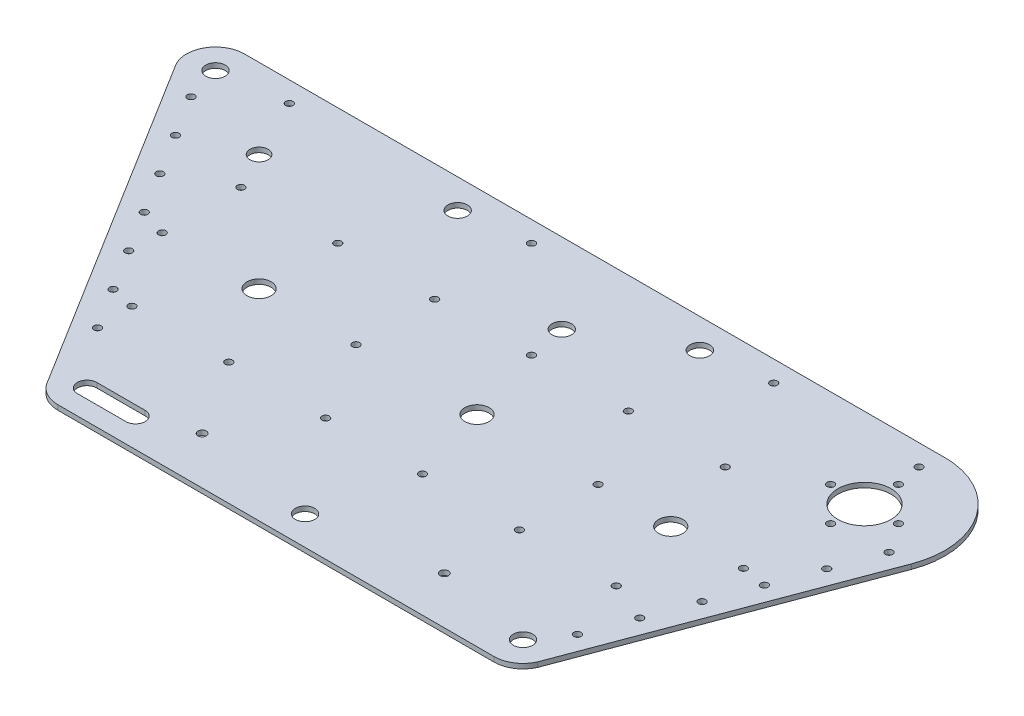
from build123d import *

# Parameters (mm, degrees)
SKETCH2_R           = 1.5
SKETCH2_R_2         = 1.75
SKETCH2_R_3         = 4
SKETCH2_R_4         = 5
BOSS_EXTRUDE1_DEPTH = 2


with BuildPart() as part:
    # Sketch2 → Boss-Extrude1 (new body)
    with BuildSketch(Plane(origin=(0, 0, 0), x_dir=(1, 0, 0), z_dir=(0, 1, 0))):
        with BuildLine():
            Line((182.962816245, 145.197156615), (-106.00499968, 144.943614194))
            add(Edge.make_bspline(
                [(-106.00499968, 144.943614194), (-127.678824036, 144.924558741), (-116.08526313, 126.611232779)],
                knots=[0.000879148, 0.000879148, 0.000879148, 2.135198153, 2.135198153, 2.135198153], degree=2, weights=[1, 0.482613975, 1]))
            Line((-116.08526313, 126.611232779), (-29.699861268, -12.428586042))
            add(Edge.make_bspline(
                [(-29.699861268, -12.428586042), (-26.366669696, -18.999958873), (-18.998606102, -18.99996049)],
                knots=[5.181825727, 5.181825727, 5.181825727, 6.283185508, 6.283185508, 6.283185508], degree=2, weights=[1, 0.852168955, 1]))
            Line((-18.998606102, -18.99996049), (160.992350179, -19))
            add(Edge.make_bspline(
                [(160.992350179, -19), (168.692373591, -19.000128232), (171.90071668, -12.000000001)],
                knots=[3.141576001, 3.141576001, 3.141576001, 4.282613549, 4.282613549, 4.282613549], degree=2, weights=[1, 0.841620915, 1]))
            Line((171.90071668, -12.000000001), (214.069631291, 100.332253712))
            add(Edge.make_bspline(
                [(214.069631291, 100.332253712), (230.927799732, 145.239327045), (182.962816245, 145.197156615)],
                knots=[4.353250182, 4.353250182, 4.353250182, 6.284064455, 6.284064455, 6.284064455], degree=2, weights=[1, 0.569082143, 1]))
        make_face()
        with Locations((-38.361920415, 16.671266638)):
            Circle(SKETCH2_R, mode=Mode.SUBTRACT)
        with BuildLine():
            add(Edge.make_bspline(
                [(-18.998603467, -3), (-22.998556935, -3), (-22.998556935, -7), (-22.998556935, -11), (-18.998603467, -11)],
                knots=[3.141592654, 3.141592654, 3.141592654, 4.71238898, 4.71238898, 6.283185307, 6.283185307, 6.283185307], degree=2, weights=[1, 0.707106781, 1, 0.707106781, 1]))
            Line((-18.998603467, -3), (1.00035, -3))
            add(Edge.make_bspline(
                [(1.00035, -11), (5.00035, -11), (5.00035, -7), (5.00035, -3), (1.00035, -3)],
                knots=[3.141592654, 3.141592654, 3.141592654, 4.71238898, 4.71238898, 6.283185307, 6.283185307, 6.283185307], degree=2, weights=[1, 0.707106781, 1, 0.707106781, 1]))
            Line((1.00035, -11), (-18.998603467, -11))
        make_face(mode=Mode.SUBTRACT)
        with Locations((20.99895, 0.5)):
            Circle(SKETCH2_R_2, mode=Mode.SUBTRACT)
        with BuildLine():
            add(Edge.make_bspline(
                [(-38.99805, 32.999994311), (-41.595996308, 32.999994311), (-40.297023154, 30.749994311), (-38.99805, 28.499994311), (-37.699076846, 30.749994311), (-36.400103692, 32.999994311), (-38.99805, 32.999994311)],
                knots=[0, 0, 0, 2.094395102, 2.094395102, 4.188790205, 4.188790205, 6.283185307, 6.283185307, 6.283185307], degree=2, weights=[1, 0.5, 1, 0.5, 1, 0.5, 1]))
        make_face(mode=Mode.SUBTRACT)
        with Locations((-48.916261932, 33.658786529)):
            Circle(SKETCH2_R, mode=Mode.SUBTRACT)
        with Locations((-59.470762984, 50.646563195)):
            Circle(SKETCH2_R, mode=Mode.SUBTRACT)
        with BuildLine():
            add(Edge.make_bspline(
                [(0.99995, 32.999992415), (-1.597996308, 32.999992415), (-0.299023154, 30.749992415), (0.99995, 28.499992415), (2.298923154, 30.749992415), (3.597896308, 32.999992415), (0.99995, 32.999992415)],
                knots=[0, 0, 0, 2.094395102, 2.094395102, 4.188790205, 4.188790205, 6.283185307, 6.283185307, 6.283185307], degree=2, weights=[1, 0.5, 1, 0.5, 1, 0.5, 1]))
        make_face(mode=Mode.SUBTRACT)
        with BuildLine():
            add(Edge.make_bspline(
                [(40.99795, 32.999988622), (38.400003692, 32.999988622), (39.698976846, 30.749988622), (40.99795, 28.499988622), (42.296923154, 30.749988622), (43.595896308, 32.999988622), (40.99795, 32.999988622)],
                knots=[0, 0, 0, 2.094395102, 2.094395102, 4.188790205, 4.188790205, 6.283185307, 6.283185307, 6.283185307], degree=2, weights=[1, 0.5, 1, 0.5, 1, 0.5, 1]))
        make_face(mode=Mode.SUBTRACT)
        with Locations((70.99665, -7)):
            Circle(SKETCH2_R_3, mode=Mode.SUBTRACT)
        with Locations((120.99395, 0.5)):
            Circle(SKETCH2_R_2, mode=Mode.SUBTRACT)
        with BuildLine():
            add(Edge.make_bspline(
                [(160.99255, -3), (154.06434677, -3), (157.528448385, -9), (160.99255, -15), (164.456651615, -9), (167.92075323, -3), (160.99255, -3)],
                knots=[0, 0, 0, 2.094395102, 2.094395102, 4.188790205, 4.188790205, 6.283185307, 6.283185307, 6.283185307], degree=2, weights=[1, 0.5, 1, 0.5, 1, 0.5, 1]))
        make_face(mode=Mode.SUBTRACT)
        with Locations((170.332531489, 6.118627774)):
            Circle(SKETCH2_R, mode=Mode.SUBTRACT)
        with BuildLine():
            add(Edge.make_bspline(
                [(80.99595, 32.999985778), (78.398003692, 32.999985778), (79.696976846, 30.749985778), (80.99595, 28.499985778), (82.294923154, 30.749985778), (83.593896308, 32.999985778), (80.99595, 32.999985778)],
                knots=[0, 0, 0, 2.094395102, 2.094395102, 4.188790205, 4.188790205, 6.283185307, 6.283185307, 6.283185307], degree=2, weights=[1, 0.5, 1, 0.5, 1, 0.5, 1]))
        make_face(mode=Mode.SUBTRACT)
        with BuildLine():
            add(Edge.make_bspline(
                [(120.99395, 32.999981037), (118.396003692, 32.999981037), (119.694976846, 30.749981037), (120.99395, 28.499981037), (122.292923154, 30.749981037), (123.591896308, 32.999981037), (120.99395, 32.999981037)],
                knots=[0, 0, 0, 2.094395102, 2.094395102, 4.188790205, 4.188790205, 6.283185307, 6.283185307, 6.283185307], degree=2, weights=[1, 0.5, 1, 0.5, 1, 0.5, 1]))
        make_face(mode=Mode.SUBTRACT)
        with BuildLine():
            add(Edge.make_bspline(
                [(160.99195, 32.999978192), (158.394003692, 32.999978192), (159.692976846, 30.749978192), (160.99195, 28.499978192), (162.290923154, 30.749978192), (163.589896308, 32.999978192), (160.99195, 32.999978192)],
                knots=[0, 0, 0, 2.094395102, 2.094395102, 4.188790205, 4.188790205, 6.283185307, 6.283185307, 6.283185307], degree=2, weights=[1, 0.5, 1, 0.5, 1, 0.5, 1]))
        make_face(mode=Mode.SUBTRACT)
        with Locations((177.330672341, 24.854456596)):
            Circle(SKETCH2_R, mode=Mode.SUBTRACT)
        with Locations((184.328557385, 43.589600555)):
            Circle(SKETCH2_R, mode=Mode.SUBTRACT)
        with Locations((191.32646769, 62.324812144)):
            Circle(SKETCH2_R, mode=Mode.SUBTRACT)
        with Locations((-70.02547384, 67.634677545)):
            Circle(SKETCH2_R, mode=Mode.SUBTRACT)
        with BuildLine():
            add(Edge.make_bspline(
                [(-58.99705, 65.5), (-61.594996308, 65.5), (-60.296023154, 63.25), (-58.99705, 61), (-57.698076846, 63.25), (-56.399103692, 65.5), (-58.99705, 65.5)],
                knots=[0, 0, 0, 2.094395102, 2.094395102, 4.188790205, 4.188790205, 6.283185307, 6.283185307, 6.283185307], degree=2, weights=[1, 0.5, 1, 0.5, 1, 0.5, 1]))
        make_face(mode=Mode.SUBTRACT)
        with BuildLine():
            add(Edge.make_bspline(
                [(-91.134705429, 103.110600241), (-93.732651737, 103.110600241), (-92.433678583, 100.860600241), (-91.134705429, 98.610600241), (-89.835732276, 100.860600241), (-88.536759122, 103.110600241), (-91.134705429, 103.110600241)],
                knots=[0, 0, 0, 2.094395102, 2.094395102, 4.188790205, 4.188790205, 6.283185307, 6.283185307, 6.283185307], degree=2, weights=[1, 0.5, 1, 0.5, 1, 0.5, 1]))
        make_face(mode=Mode.SUBTRACT)
        with Locations((-80.580283096, 84.622950275)):
            Circle(SKETCH2_R, mode=Mode.SUBTRACT)
        with BuildLine():
            add(Edge.make_bspline(
                [(-58.99705, 98), (-61.594996308, 98), (-60.296023154, 95.75), (-58.99705, 93.5), (-57.698076846, 95.75), (-56.399103692, 98), (-58.99705, 98)],
                knots=[0, 0, 0, 2.094395102, 2.094395102, 4.188790205, 4.188790205, 6.283185307, 6.283185307, 6.283185307], degree=2, weights=[1, 0.5, 1, 0.5, 1, 0.5, 1]))
        make_face(mode=Mode.SUBTRACT)
        with Locations((-18.9988, 64)):
            Circle(SKETCH2_R_4, mode=Mode.SUBTRACT)
        with BuildLine():
            add(Edge.make_bspline(
                [(20.99895, 65.5), (18.401003692, 65.5), (19.699976846, 63.25), (20.99895, 61), (22.297923154, 63.25), (23.596896308, 65.5), (20.99895, 65.5)],
                knots=[0, 0, 0, 2.094395102, 2.094395102, 4.188790205, 4.188790205, 6.283185307, 6.283185307, 6.283185307], degree=2, weights=[1, 0.5, 1, 0.5, 1, 0.5, 1]))
        make_face(mode=Mode.SUBTRACT)
        with BuildLine():
            add(Edge.make_bspline(
                [(-18.99905, 98), (-21.596996308, 98), (-20.298023154, 95.75), (-18.99905, 93.5), (-17.700076846, 95.75), (-16.401103692, 98), (-18.99905, 98)],
                knots=[0, 0, 0, 2.094395102, 2.094395102, 4.188790205, 4.188790205, 6.283185307, 6.283185307, 6.283185307], degree=2, weights=[1, 0.5, 1, 0.5, 1, 0.5, 1]))
        make_face(mode=Mode.SUBTRACT)
        with BuildLine():
            add(Edge.make_bspline(
                [(20.99895, 98), (18.401003692, 98), (19.699976846, 95.75), (20.99895, 93.5), (22.297923154, 95.75), (23.596896308, 98), (20.99895, 98)],
                knots=[0, 0, 0, 2.094395102, 2.094395102, 4.188790205, 4.188790205, 6.283185307, 6.283185307, 6.283185307], degree=2, weights=[1, 0.5, 1, 0.5, 1, 0.5, 1]))
        make_face(mode=Mode.SUBTRACT)
        with BuildLine():
            add(Edge.make_bspline(
                [(-101.689209002, 120.098380963), (-104.287155309, 120.098380963), (-102.988182156, 117.848380963), (-101.689209002, 115.598380963), (-100.390235848, 117.848380963), (-99.091262694, 120.098380963), (-101.689209002, 120.098380963)],
                knots=[0, 0, 0, 2.094395102, 2.094395102, 4.188790205, 4.188790205, 6.283185307, 6.283185307, 6.283185307], degree=2, weights=[1, 0.5, 1, 0.5, 1, 0.5, 1]))
        make_face(mode=Mode.SUBTRACT)
        with BuildLine():
            add(Edge.make_bspline(
                [(-66.99665, 115.75), (-73.491515769, 115.75), (-70.244082884, 110.125), (-66.99665, 104.5), (-63.749217116, 110.125), (-60.501784231, 115.75), (-66.99665, 115.75)],
                knots=[0, 0, 0, 2.094395102, 2.094395102, 4.188790205, 4.188790205, 6.283185307, 6.283185307, 6.283185307], degree=2, weights=[1, 0.5, 1, 0.5, 1, 0.5, 1]))
        make_face(mode=Mode.SUBTRACT)
        with BuildLine():
            add(Edge.make_bspline(
                [(-109.9945, 133), (-109.9945, 126.07179677), (-103.9945, 129.535898385), (-97.9945, 133), (-103.9945, 136.464101615), (-109.9945, 139.92820323), (-109.9945, 133)],
                knots=[0, 0, 0, 2.094395102, 2.094395102, 4.188790205, 4.188790205, 6.283185307, 6.283185307, 6.283185307], degree=2, weights=[1, 0.5, 1, 0.5, 1, 0.5, 1]))
        make_face(mode=Mode.SUBTRACT)
        with Locations((-78.996040132, 136.5)):
            Circle(SKETCH2_R, mode=Mode.SUBTRACT)
        with BuildLine():
            add(Edge.make_bspline(
                [(-5.9995, 137), (-12.92770323, 137), (-9.463601615, 131), (-5.9995, 125), (-2.535398385, 131), (0.92870323, 137), (-5.9995, 137)],
                knots=[0, 0, 0, 2.094395102, 2.094395102, 4.188790205, 4.188790205, 6.283185307, 6.283185307, 6.283185307], degree=2, weights=[1, 0.5, 1, 0.5, 1, 0.5, 1]))
        make_face(mode=Mode.SUBTRACT)
        with Locations((20.99895, 136.5)):
            Circle(SKETCH2_R, mode=Mode.SUBTRACT)
        with Locations((70.99645, 64)):
            Circle(SKETCH2_R_4, mode=Mode.SUBTRACT)
        with BuildLine():
            add(Edge.make_bspline(
                [(120.99395, 65.5), (118.396003692, 65.5), (119.694976846, 63.25), (120.99395, 61), (122.292923154, 63.25), (123.591896308, 65.5), (120.99395, 65.5)],
                knots=[0, 0, 0, 2.094395102, 2.094395102, 4.188790205, 4.188790205, 6.283185307, 6.283185307, 6.283185307], degree=2, weights=[1, 0.5, 1, 0.5, 1, 0.5, 1]))
        make_face(mode=Mode.SUBTRACT)
        with BuildLine():
            add(Edge.make_bspline(
                [(60.99695, 98), (58.399003692, 98), (59.697976846, 95.75), (60.99695, 93.5), (62.295923154, 95.75), (63.594896308, 98), (60.99695, 98)],
                knots=[0, 0, 0, 2.094395102, 2.094395102, 4.188790205, 4.188790205, 6.283185307, 6.283185307, 6.283185307], degree=2, weights=[1, 0.5, 1, 0.5, 1, 0.5, 1]))
        make_face(mode=Mode.SUBTRACT)
        with BuildLine():
            add(Edge.make_bspline(
                [(100.99495, 98), (98.397003692, 98), (99.695976846, 95.75), (100.99495, 93.5), (102.293923154, 95.75), (103.592896308, 98), (100.99495, 98)],
                knots=[0, 0, 0, 2.094395102, 2.094395102, 4.188790205, 4.188790205, 6.283185307, 6.283185307, 6.283185307], degree=2, weights=[1, 0.5, 1, 0.5, 1, 0.5, 1]))
        make_face(mode=Mode.SUBTRACT)
        with BuildLine():
            add(Edge.make_bspline(
                [(140.99295, 98), (138.395003692, 98), (139.693976846, 95.75), (140.99295, 93.5), (142.291923154, 95.75), (143.590896308, 98), (140.99295, 98)],
                knots=[0, 0, 0, 2.094395102, 2.094395102, 4.188790205, 4.188790205, 6.283185307, 6.283185307, 6.283185307], degree=2, weights=[1, 0.5, 1, 0.5, 1, 0.5, 1]))
        make_face(mode=Mode.SUBTRACT)
        with Locations((150.9927, 64)):
            Circle(SKETCH2_R_4, mode=Mode.SUBTRACT)
        with BuildLine():
            add(Edge.make_bspline(
                [(180.99095, 65.5), (178.393003692, 65.5), (179.691976846, 63.25), (180.99095, 61), (182.289923154, 63.25), (183.588896308, 65.5), (180.99095, 65.5)],
                knots=[0, 0, 0, 2.094395102, 2.094395102, 4.188790205, 4.188790205, 6.283185307, 6.283185307, 6.283185307], degree=2, weights=[1, 0.5, 1, 0.5, 1, 0.5, 1]))
        make_face(mode=Mode.SUBTRACT)
        with Locations((198.324441471, 81.060193672)):
            Circle(SKETCH2_R, mode=Mode.SUBTRACT)
        with BuildLine():
            add(Edge.make_bspline(
                [(182.99085, 99.5), (180.392903692, 99.5), (181.691876846, 97.25), (182.99085, 95), (184.289823154, 97.25), (185.588796308, 99.5), (182.99085, 99.5)],
                knots=[0, 0, 0, 2.094395102, 2.094395102, 4.188790205, 4.188790205, 6.283185307, 6.283185307, 6.283185307], degree=2, weights=[1, 0.5, 1, 0.5, 1, 0.5, 1]))
        make_face(mode=Mode.SUBTRACT)
        with BuildLine():
            add(Edge.make_bspline(
                [(205.322481122, 101.295751553), (202.724534814, 101.295751553), (204.023507968, 99.045751553), (205.322481122, 96.795751553), (206.621454275, 99.045751553), (207.920427429, 101.295751553), (205.322481122, 101.295751553)],
                knots=[0, 0, 0, 2.094395102, 2.094395102, 4.188790205, 4.188790205, 6.283185307, 6.283185307, 6.283185307], degree=2, weights=[1, 0.5, 1, 0.5, 1, 0.5, 1]))
        make_face(mode=Mode.SUBTRACT)
        with BuildLine():
            add(Edge.make_bspline(
                [(53.9973, 112), (53.9973, 105.07179677), (59.9973, 108.535898385), (65.9973, 112), (59.9973, 115.464101615), (53.9973, 118.92820323), (53.9973, 112)],
                knots=[0, 0, 0, 2.094395102, 2.094395102, 4.188790205, 4.188790205, 6.283185307, 6.283185307, 6.283185307], degree=2, weights=[1, 0.5, 1, 0.5, 1, 0.5, 1]))
        make_face(mode=Mode.SUBTRACT)
        with BuildLine():
            add(Edge.make_bspline(
                [(89.995420809, 133), (89.995420809, 126.07179677), (95.995420809, 129.535898385), (101.995420809, 133), (95.995420809, 136.464101615), (89.995420809, 139.92820323), (89.995420809, 133)],
                knots=[0, 0, 0, 2.094395102, 2.094395102, 4.188790205, 4.188790205, 6.283185307, 6.283185307, 6.283185307], degree=2, weights=[1, 0.5, 1, 0.5, 1, 0.5, 1]))
        make_face(mode=Mode.SUBTRACT)
        with Locations((120.99395, 136.5)):
            Circle(SKETCH2_R, mode=Mode.SUBTRACT)
        with BuildLine():
            add(Edge.make_bspline(
                [(168.99155, 113.5), (166.393603692, 113.5), (167.692576846, 111.25), (168.99155, 109), (170.290523154, 111.25), (171.589496308, 113.5), (168.99155, 113.5)],
                knots=[0, 0, 0, 2.094395102, 2.094395102, 4.188790205, 4.188790205, 6.283185307, 6.283185307, 6.283185307], degree=2, weights=[1, 0.5, 1, 0.5, 1, 0.5, 1]))
        make_face(mode=Mode.SUBTRACT)
        with BuildLine():
            ThreePointArc((182.992000002, 122.999999999), (190.770174595, 119.778174592), (193.992000002, 111.999999999))
            ThreePointArc((193.992000002, 111.999999999), (175.213825408, 104.221825406), (182.992000002, 122.999999999))
        make_face(mode=Mode.SUBTRACT)
        with BuildLine():
            add(Edge.make_bspline(
                [(196.99015, 113.5), (194.392203692, 113.5), (195.691176846, 111.25), (196.99015, 109), (198.289123154, 111.25), (199.588096308, 113.5), (196.99015, 113.5)],
                knots=[0, 0, 0, 2.094395102, 2.094395102, 4.188790205, 4.188790205, 6.283185307, 6.283185307, 6.283185307], degree=2, weights=[1, 0.5, 1, 0.5, 1, 0.5, 1]))
        make_face(mode=Mode.SUBTRACT)
        with BuildLine():
            add(Edge.make_bspline(
                [(182.99085, 127.5), (180.392903692, 127.5), (181.691876846, 125.25), (182.99085, 123), (184.289823154, 125.25), (185.588796308, 127.5), (182.99085, 127.5)],
                knots=[0, 0, 0, 2.094395102, 2.094395102, 4.188790205, 4.188790205, 6.283185307, 6.283185307, 6.283185307], degree=2, weights=[1, 0.5, 1, 0.5, 1, 0.5, 1]))
        make_face(mode=Mode.SUBTRACT)
        with Locations((180.99095, 136.5)):
            Circle(SKETCH2_R, mode=Mode.SUBTRACT)
    extrude(amount=BOSS_EXTRUDE1_DEPTH)


solid = part.part
